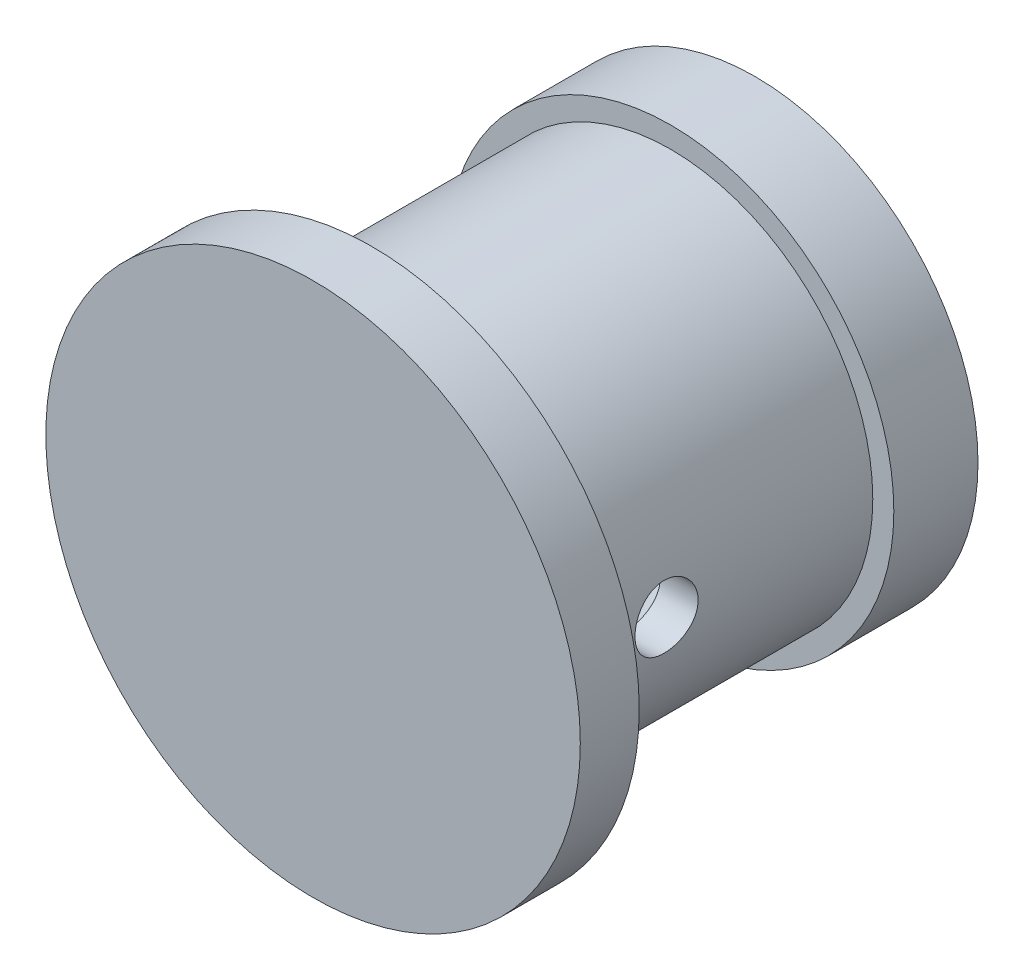
from build123d import *

# Parameters (mm, degrees)
SKETCH1_R           = 5.3
SKETCH1_R_2         = 3.9
EXTRUDE1_DEPTH      = 2
SKETCH2_R           = 4.8
SKETCH2_R_2         = 3.9
EXTRUDE2_DEPTH      = 7.5
EXTRUDE3_DEPTH      = 13.100826418
EXTRUDE3_DEPTH_BACK = 13.100826418
SKETCH4_R           = 0.75
EXTRUDE4_DEPTH      = 1
EXTRUDE4_DEPTH_BACK = 0.4
SKETCH5_R           = 6.35


with BuildPart() as part:
    # Sketch1 → Extrude1 (new body)
    with BuildSketch(Plane.XY):
        Circle(SKETCH1_R)
        Circle(SKETCH1_R_2, mode=Mode.SUBTRACT)
    extrude(amount=EXTRUDE1_DEPTH)

    # Sketch2 → Extrude2 (add)
    with BuildSketch(Plane.XY.offset(2)):
        Circle(SKETCH2_R)
        Circle(SKETCH2_R_2, mode=Mode.SUBTRACT)
    extrude(amount=EXTRUDE2_DEPTH)

    # Sketch4 → Extrude3 (cut, two sides: drawn at the far end of the back side and taken through both)
    with BuildSketch(Plane(origin=(0, 0, 0), x_dir=(0, 0, -1), z_dir=(1, 0, 0)).offset(-EXTRUDE3_DEPTH_BACK)):
        with Locations((-6.9, 0)):
            Circle(SKETCH4_R)
    extrude(amount=EXTRUDE3_DEPTH + EXTRUDE3_DEPTH_BACK, mode=Mode.SUBTRACT)

    # Sketch5 → Extrude4 (add, two sides: drawn at the far end of the back side and taken through both)
    with BuildSketch(Plane.XY.offset(9.5).offset(-EXTRUDE4_DEPTH_BACK)):
        Circle(SKETCH5_R)
    extrude(amount=EXTRUDE4_DEPTH + EXTRUDE4_DEPTH_BACK)


solid = part.part
